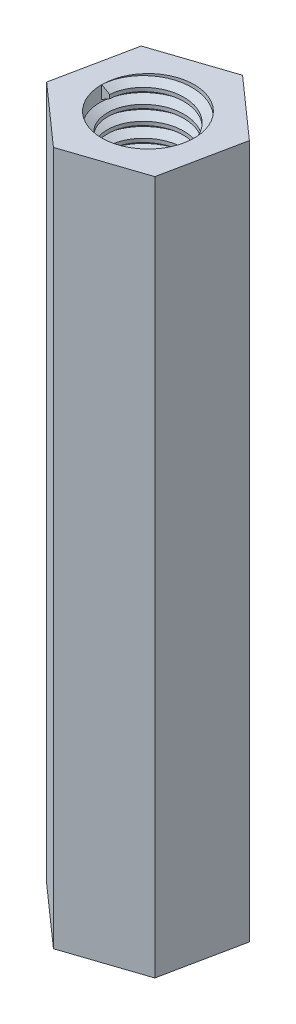
from build123d import *
from build123d.topology import SkipClean

# Parameters (mm, degrees)
EXTRUDE_1_DEPTH     = 15
SKETCH_2_R          = 1
CUT_EXTRUDE_1_DEPTH = 16.184840908
THREAD_1_PITCH      = 0.3175


with BuildPart() as part:
    # Sketch 1 → 凸台-拉伸1 (new body)
    with BuildSketch(Plane(origin=(0, 0, 0), x_dir=(1, 0, 0), z_dir=(0, 1, 0))):
        Polygon((1.295979961, -1.149102232), (1.643141705, 0.547800453), (0.347161744, 1.696902685), (-1.295979961, 1.149102232), (-1.643141705, -0.547800453), (-0.347161744, -1.696902685), align=None)
    extrude(amount=EXTRUDE_1_DEPTH)

    # 草图2 → 切除-拉伸1 (cut, through all)
    with BuildSketch(Plane(origin=(0, 15, 0), x_dir=(1, 0, 0), z_dir=(0, 1, 0))):
        with Locations(Location((0, 0, 0), (0, 0, 270))):
            Circle(SKETCH_2_R)
    extrude(amount=-CUT_EXTRUDE_1_DEPTH, mode=Mode.SUBTRACT)

    # 螺纹线1: the profile of Sketch 1 2 profile screwed along a right-hand helix of 46.299213 turns, 6 arcs to a turn; built about Z, then put on its axis
    with SkipClean():  # the faces are left unmerged after this step: merging them gives an invalid solid
        thread_1_z = Axis((0, 0, 0), (0, 0, 1))
        thread_1_corners = [(1.0003, 0, -0.000173205), (1.0003, 0, 0.277985704), (0.828148085, 0, 0.17859375), (0.828148085, 0, 0.09921875)]
        with BuildLine(mode=Mode.PRIVATE) as thread_1_profile:
            Line(thread_1_corners[0], thread_1_corners[1])
            Line(thread_1_corners[1], thread_1_corners[2])
            Line(thread_1_corners[2], thread_1_corners[3])
            Line(thread_1_corners[3], thread_1_corners[0])
        thread_1_cap = Face(thread_1_profile.wire())
        thread_1_turn_angles = [0, 30, 60, 90, 120, 150, 180, 210, 240, 270, 300, 330, 360, 390, 420, 450, 480, 510, 540, 570, 600, 630, 660, 690, 720]
        thread_1_turn_weights = [1, 0.8660254037844387, 1, 0.8660254037844387, 1, 0.8660254037844387, 1, 0.8660254037844387, 1, 0.8660254037844387, 1, 0.8660254037844387, 1, 0.8660254037844387, 1, 0.8660254037844387, 1, 0.8660254037844387, 1, 0.8660254037844387, 1, 0.8660254037844387, 1, 0.8660254037844387, 1]
        thread_1_turn_rails = [Edge.make_bspline([Vector(p[0], p[1], 0).rotate(thread_1_z, thread_1_turn_angles[k]) / thread_1_turn_weights[k] + Vector(0, 0, p[2] + THREAD_1_PITCH * thread_1_turn_angles[k] / 360) for k in range(25)], [0, 0, 0, 1, 1, 2, 2, 3, 3, 4, 4, 5, 5, 6, 6, 7, 7, 8, 8, 9, 9, 10, 10, 11, 11, 12, 12, 12], 2, thread_1_turn_weights) for p in thread_1_corners]
        thread_1_turn_sides = [Face.make_surface_from_curves(thread_1_turn_rails[p[0]], thread_1_turn_rails[p[1]]) for p in [(0, 1), (1, 2), (2, 3), (3, 0)]]
        thread_1_last_angles = [16560, 16590, 16620, 16643.858267717, 16667.716535433]
        thread_1_last_weights = [1, 0.8660254037844387, 1, 0.914548803950747, 1]
        thread_1_last_rails = [Edge.make_bspline([Vector(p[0], p[1], 0).rotate(thread_1_z, thread_1_last_angles[k]) / thread_1_last_weights[k] + Vector(0, 0, p[2] + THREAD_1_PITCH * thread_1_last_angles[k] / 360) for k in range(5)], [0, 0, 0, 1, 1, 2, 2, 2], 2, thread_1_last_weights) for p in thread_1_corners]
        thread_1_last_sides = [Face.make_surface_from_curves(thread_1_last_rails[p[0]], thread_1_last_rails[p[1]]) for p in [(0, 1), (1, 2), (2, 3), (3, 0)]]
        thread_1 = Plane(origin=(0, 15, 0), x_dir=(-1, 0, 0), z_dir=(0, -1, 0)) * Solid(Shell([*[p.moved(Location((0, 0, 2 * THREAD_1_PITCH * i))) for i in range(23) for p in thread_1_turn_sides], *thread_1_last_sides, thread_1_cap, thread_1_cap.rotate(thread_1_z, 16667.716535433).moved(Location((0, 0, THREAD_1_PITCH * 16667.716535433 / 360)))]))
        add(thread_1)


solid = part.part
